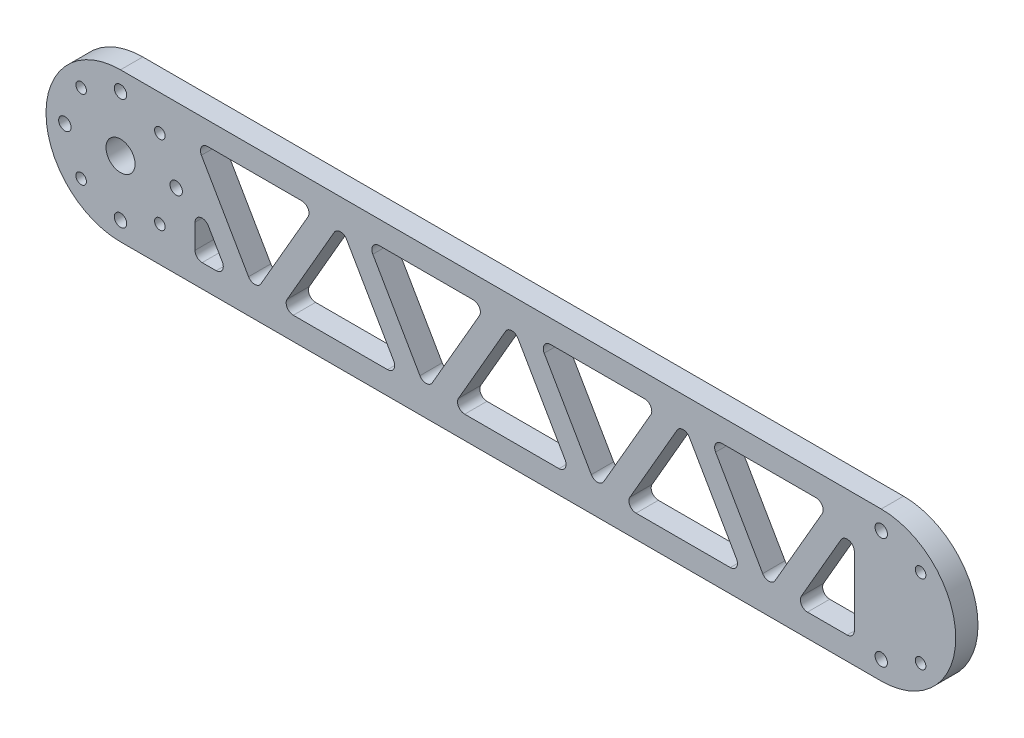
from build123d import *

# Parameters (mm, degrees)
SKETCH1_R              = 4
SKETCH1_R_2            = 1.75
SKETCH1_R_3            = 1.5
BOSS_EXTRUDE1_DEPTH    = 6
CUT_EXTRUDE1_DEPTH     = 226.966811722
FILLET1_R              = 2
MOVE_FACE1_OUTLINE_R   = 4
MOVE_FACE1_OUTLINE_R_2 = 3.92
MOVE_FACE1_OUTLINE_R_3 = 1.75
MOVE_FACE1_OUTLINE_R_4 = 1.67
MOVE_FACE1_OUTLINE_R_5 = 1.5
MOVE_FACE1_OUTLINE_R_6 = 1.42
MOVE_FACE1_DEPTH       = 6


# Read off the part's stored shape, not the designer's step: Move Face1
with BuildPart() as part:
    # Sketch1 → Boss-Extrude1 (new body)
    with BuildSketch(Plane.XY):
        with BuildLine():
            Line((205, 20), (0, 20))
            ThreePointArc((0, 20), (-20, 0), (0, -20))
            Line((0, -20), (205, -20))
            ThreePointArc((205, -20), (225, 0), (205, 20))
        make_face()
        Circle(SKETCH1_R, mode=Mode.SUBTRACT)
        with Locations((205, -15)):
            Circle(SKETCH1_R_2, mode=Mode.SUBTRACT)
        with Locations((215.606601718, -10.606601718)):
            Circle(SKETCH1_R_3, mode=Mode.SUBTRACT)
        with Locations((205, 15)):
            Circle(SKETCH1_R_2, mode=Mode.SUBTRACT)
        with Locations((215.606601718, 10.606601718)):
            Circle(SKETCH1_R_3, mode=Mode.SUBTRACT)
        with Locations((0, -15)):
            Circle(SKETCH1_R_2, mode=Mode.SUBTRACT)
        with Locations((10.606601718, -10.606601718)):
            Circle(SKETCH1_R_3, mode=Mode.SUBTRACT)
        with Locations((-15, 0)):
            Circle(SKETCH1_R_2, mode=Mode.SUBTRACT)
        with Locations((-10.606601718, -10.606601718)):
            Circle(SKETCH1_R_3, mode=Mode.SUBTRACT)
        with Locations((0, 15)):
            Circle(SKETCH1_R_2, mode=Mode.SUBTRACT)
        with Locations((-10.606601718, 10.606601718)):
            Circle(SKETCH1_R_3, mode=Mode.SUBTRACT)
        with Locations((15, 0)):
            Circle(SKETCH1_R_2, mode=Mode.SUBTRACT)
        with Locations((10.606601718, 10.606601718)):
            Circle(SKETCH1_R_3, mode=Mode.SUBTRACT)
    extrude(amount=BOSS_EXTRUDE1_DEPTH)

    # Sketch2 → Cut-Extrude1 (cut, through all)
    with BuildSketch(Plane.XY.offset(6)):
        Polygon((20, 14), (52.331615075, 14), (36.165807537, -14), align=None)
        Polygon((43.094010768, -14), (59.259818305, 14), (75.425625842, -14), align=None)
        Polygon((66.188021535, 14), (82.353829072, -14), (98.51963661, 14), align=None)
        Polygon((89.282032303, -14), (105.44783984, 14), (121.613647377, -14), align=None)
        Polygon((112.37604307, 14), (128.541850608, -14), (144.707658145, 14), align=None)
        Polygon((20, 2), (20, -14), (29.237604307, -14), align=None)
        Polygon((135.470053838, -14), (151.635861375, 14), (167.801668913, -14), align=None)
        Polygon((174.729872143, -14), (158.564064606, 14), (190.89567968, 14), align=None)
        Polygon((181.658075373, -14), (197.82388291, 14), (197.82388291, -14), align=None)
    extrude(amount=-CUT_EXTRUDE1_DEPTH, mode=Mode.SUBTRACT)

    # Fillet1
    fillet1_edges = [part.edges().sort_by_distance(p)[0] for p in [
        (121.613647377, -14, 3),
        (89.282032303, -14, 3),
        (105.44783984, 14, 3),
        (112.37604307, 14, 3),
        (144.707658145, 14, 3),
        (128.541850608, -14, 3),
        (20, 2, 3),
        (29.237604307, -14, 3),
        (20, -14, 3),
        (167.801668913, -14, 3),
        (135.470053838, -14, 3),
        (151.635861375, 14, 3),
        (190.89567968, 14, 3),
        (174.729872143, -14, 3),
        (158.564064606, 14, 3),
        (197.82388291, -14, 3),
        (181.658075373, -14, 3),
        (197.82388291, 14, 3),
        (36.165807537, -14, 3),
        (20, 14, 3),
        (52.331615075, 14, 3),
        (75.425625842, -14, 3),
        (43.094010768, -14, 3),
        (59.259818305, 14, 3),
        (66.188021535, 14, 3),
        (98.51963661, 14, 3),
        (82.353829072, -14, 3),
    ]]
    fillet(fillet1_edges, radius=FILLET1_R)

    # Move Face1 outline → Move Face1 (add)
    # profile 1 of 23: a face of its own
    with BuildSketch(Plane.XY):
        with BuildLine():
            ThreePointArc((205, -20.08), (225.08, 0), (205, 20.08))
            Line((205, 20.08), (0, 20.08))
            ThreePointArc((0, 20.08), (-20.08, 0), (0, -20.08))
            Line((0, -20.08), (205, -20.08))
        make_face()
        with BuildLine():
            Line((0, 20), (205, 20))
            ThreePointArc((205, 20), (225, 0), (205, -20))
            Line((205, -20), (0, -20))
            ThreePointArc((0, -20), (-20, 0), (0, 20))
        make_face(mode=Mode.SUBTRACT)
    # profile 2 of 23: a face of its own
    with BuildSketch(Plane.XY):
        Circle(MOVE_FACE1_OUTLINE_R)
        Circle(MOVE_FACE1_OUTLINE_R_2, mode=Mode.SUBTRACT)
    # profile 3 of 23: a face of its own
    with BuildSketch(Plane.XY):
        with Locations((205, -15)):
            Circle(MOVE_FACE1_OUTLINE_R_3)
        with Locations((205, -15)):
            Circle(MOVE_FACE1_OUTLINE_R_4, mode=Mode.SUBTRACT)
    # profile 4 of 23: a face of its own
    with BuildSketch(Plane.XY):
        with Locations((215.606601718, -10.606601718)):
            Circle(MOVE_FACE1_OUTLINE_R_5)
        with Locations((215.606601718, -10.606601718)):
            Circle(MOVE_FACE1_OUTLINE_R_6, mode=Mode.SUBTRACT)
    # profile 5 of 23: a face of its own
    with BuildSketch(Plane.XY):
        with Locations((205, 15)):
            Circle(MOVE_FACE1_OUTLINE_R_3)
        with Locations((205, 15)):
            Circle(MOVE_FACE1_OUTLINE_R_4, mode=Mode.SUBTRACT)
    # profile 6 of 23: a face of its own
    with BuildSketch(Plane.XY):
        with Locations((215.606601718, 10.606601718)):
            Circle(MOVE_FACE1_OUTLINE_R_5)
        with Locations((215.606601718, 10.606601718)):
            Circle(MOVE_FACE1_OUTLINE_R_6, mode=Mode.SUBTRACT)
    # profile 7 of 23: a face of its own
    with BuildSketch(Plane.XY):
        with Locations((0, -15)):
            Circle(MOVE_FACE1_OUTLINE_R_3)
        with Locations((0, -15)):
            Circle(MOVE_FACE1_OUTLINE_R_4, mode=Mode.SUBTRACT)
    # profile 8 of 23: a face of its own
    with BuildSketch(Plane.XY):
        with Locations((10.606601718, -10.606601718)):
            Circle(MOVE_FACE1_OUTLINE_R_5)
        with Locations((10.606601718, -10.606601718)):
            Circle(MOVE_FACE1_OUTLINE_R_6, mode=Mode.SUBTRACT)
    # profile 9 of 23: a face of its own
    with BuildSketch(Plane.XY):
        with Locations((-15, 0)):
            Circle(MOVE_FACE1_OUTLINE_R_3)
        with Locations((-15, 0)):
            Circle(MOVE_FACE1_OUTLINE_R_4, mode=Mode.SUBTRACT)
    # profile 10 of 23: a face of its own
    with BuildSketch(Plane.XY):
        with Locations((-10.606601718, -10.606601718)):
            Circle(MOVE_FACE1_OUTLINE_R_5)
        with Locations((-10.606601718, -10.606601718)):
            Circle(MOVE_FACE1_OUTLINE_R_6, mode=Mode.SUBTRACT)
    # profile 11 of 23: a face of its own
    with BuildSketch(Plane.XY):
        with Locations((0, 15)):
            Circle(MOVE_FACE1_OUTLINE_R_3)
        with Locations((0, 15)):
            Circle(MOVE_FACE1_OUTLINE_R_4, mode=Mode.SUBTRACT)
    # profile 12 of 23: a face of its own
    with BuildSketch(Plane.XY):
        with Locations((-10.606601718, 10.606601718)):
            Circle(MOVE_FACE1_OUTLINE_R_5)
        with Locations((-10.606601718, 10.606601718)):
            Circle(MOVE_FACE1_OUTLINE_R_6, mode=Mode.SUBTRACT)
    # profile 13 of 23: a face of its own
    with BuildSketch(Plane.XY):
        with Locations((15, 0)):
            Circle(MOVE_FACE1_OUTLINE_R_3)
        with Locations((15, 0)):
            Circle(MOVE_FACE1_OUTLINE_R_4, mode=Mode.SUBTRACT)
    # profile 14 of 23: a face of its own
    with BuildSketch(Plane.XY):
        with Locations((10.606601718, 10.606601718)):
            Circle(MOVE_FACE1_OUTLINE_R_5)
        with Locations((10.606601718, 10.606601718)):
            Circle(MOVE_FACE1_OUTLINE_R_6, mode=Mode.SUBTRACT)
    # profile 15 of 23: a face of its own
    with BuildSketch(Plane.XY):
        with BuildLine():
            ThreePointArc((23.464101615, 14), (21.732050808, 13), (21.732050808, 11))
            Line((21.732050808, 11), (34.43375673, -11))
            ThreePointArc((34.43375673, -11), (36.165807538, -12), (37.897858345, -11))
            Line((37.897858345, -11), (50.599564267, 11))
            ThreePointArc((50.599564267, 11), (50.599564267, 13), (48.867513459, 14))
            Line((48.867513459, 14), (23.464101615, 14))
        make_face()
        with BuildLine():
            Line((34.503038762, -10.96), (21.80133284, 11.04))
            ThreePointArc((21.80133284, 11.04), (21.80133284, 12.96), (23.464101615, 13.92))
            Line((23.464101615, 13.92), (48.867513459, 13.92))
            ThreePointArc((48.867513459, 13.92), (50.530282235, 12.96), (50.530282235, 11.04))
            Line((50.530282235, 11.04), (37.828576313, -10.96))
            ThreePointArc((37.828576313, -10.96), (36.165807538, -11.92), (34.503038762, -10.96))
        make_face(mode=Mode.SUBTRACT)
    # profile 16 of 23: a face of its own
    with BuildSketch(Plane.XY):
        with BuildLine():
            ThreePointArc((96.787585802, 11), (96.787585802, 13), (95.055534995, 14))
            Line((95.055534995, 14), (69.65212315, 14))
            ThreePointArc((69.65212315, 14), (67.920072343, 13), (67.920072343, 11))
            Line((67.920072343, 11), (80.621778265, -11))
            ThreePointArc((80.621778265, -11), (82.353829072, -12), (84.08587988, -11))
            Line((84.08587988, -11), (96.787585802, 11))
        make_face()
        with BuildLine():
            Line((69.65212315, 13.92), (95.055534995, 13.92))
            ThreePointArc((95.055534995, 13.92), (96.71830377, 12.96), (96.71830377, 11.04))
            Line((96.71830377, 11.04), (84.016597848, -10.96))
            ThreePointArc((84.016597848, -10.96), (82.353829073, -11.92), (80.691060297, -10.96))
            Line((80.691060297, -10.96), (67.989354375, 11.04))
            ThreePointArc((67.989354375, 11.04), (67.989354375, 12.96), (69.65212315, 13.92))
        make_face(mode=Mode.SUBTRACT)
    # profile 17 of 23: a face of its own
    with BuildSketch(Plane.XY):
        with BuildLine():
            ThreePointArc((142.975607337, 11), (142.975607337, 13), (141.24355653, 14))
            Line((141.24355653, 14), (115.840144685, 14))
            ThreePointArc((115.840144685, 14), (114.108093878, 13), (114.108093878, 11))
            Line((114.108093878, 11), (126.8097998, -11))
            ThreePointArc((126.8097998, -11), (128.541850608, -12), (130.273901415, -11))
            Line((130.273901415, -11), (142.975607337, 11))
        make_face()
        with BuildLine():
            Line((115.840144685, 13.92), (141.24355653, 13.92))
            ThreePointArc((141.24355653, 13.92), (142.906325305, 12.96), (142.906325305, 11.04))
            Line((142.906325305, 11.04), (130.204619383, -10.96))
            ThreePointArc((130.204619383, -10.96), (128.541850608, -11.92), (126.879081832, -10.96))
            Line((126.879081832, -10.96), (114.17737591, 11.04))
            ThreePointArc((114.17737591, 11.04), (114.17737591, 12.96), (115.840144685, 13.92))
        make_face(mode=Mode.SUBTRACT)
    # profile 18 of 23: a face of its own
    with BuildSketch(Plane.XY):
        with BuildLine():
            ThreePointArc((189.163628873, 11), (189.163628873, 13), (187.431578065, 14))
            Line((187.431578065, 14), (162.028166221, 14))
            ThreePointArc((162.028166221, 14), (160.296115413, 13), (160.296115413, 11))
            Line((160.296115413, 11), (172.997821335, -11))
            ThreePointArc((172.997821335, -11), (174.729872142, -12), (176.46192295, -11))
            Line((176.46192295, -11), (189.163628873, 11))
        make_face()
        with BuildLine():
            Line((162.028166221, 13.92), (187.431578065, 13.92))
            ThreePointArc((187.431578065, 13.92), (189.09434684, 12.96), (189.09434684, 11.04))
            Line((189.09434684, 11.04), (176.392640918, -10.96))
            ThreePointArc((176.392640918, -10.96), (174.729872143, -11.92), (173.067103368, -10.96))
            Line((173.067103368, -10.96), (160.365397445, 11.04))
            ThreePointArc((160.365397445, 11.04), (160.365397445, 12.96), (162.028166221, 13.92))
        make_face(mode=Mode.SUBTRACT)
    # profile 19 of 23: a face of its own
    with BuildSketch(Plane.XY):
        with BuildLine():
            ThreePointArc((44.826061575, -11), (44.826061575, -13), (46.558112383, -14))
            Line((46.558112383, -14), (71.961524227, -14))
            ThreePointArc((71.961524227, -14), (73.693575035, -13), (73.693575035, -11))
            Line((73.693575035, -11), (60.991869112, 11))
            ThreePointArc((60.991869112, 11), (59.259818305, 12), (57.527767497, 11))
            Line((57.527767497, 11), (44.826061575, -11))
        make_face()
        with BuildLine():
            Line((71.961524227, -13.92), (46.558112383, -13.92))
            ThreePointArc((46.558112383, -13.92), (44.895343607, -12.96), (44.895343607, -11.04))
            Line((44.895343607, -11.04), (57.59704953, 10.96))
            ThreePointArc((57.59704953, 10.96), (59.259818305, 11.92), (60.92258708, 10.96))
            Line((60.92258708, 10.96), (73.624293002, -11.04))
            ThreePointArc((73.624293002, -11.04), (73.624293002, -12.96), (71.961524227, -13.92))
        make_face(mode=Mode.SUBTRACT)
    # profile 20 of 23: a face of its own
    with BuildSketch(Plane.XY):
        with BuildLine():
            ThreePointArc((91.01408311, -11), (91.01408311, -13), (92.746133918, -14))
            Line((92.746133918, -14), (118.149545762, -14))
            ThreePointArc((118.149545762, -14), (119.88159657, -13), (119.88159657, -11))
            Line((119.88159657, -11), (107.179890648, 11))
            ThreePointArc((107.179890648, 11), (105.44783984, 12), (103.715789032, 11))
            Line((103.715789032, 11), (91.01408311, -11))
        make_face()
        with BuildLine():
            Line((118.149545762, -13.92), (92.746133918, -13.92))
            ThreePointArc((92.746133918, -13.92), (91.083365143, -12.96), (91.083365143, -11.04))
            Line((91.083365143, -11.04), (103.785071065, 10.96))
            ThreePointArc((103.785071065, 10.96), (105.44783984, 11.92), (107.110608615, 10.96))
            Line((107.110608615, 10.96), (119.812314538, -11.04))
            ThreePointArc((119.812314538, -11.04), (119.812314538, -12.96), (118.149545762, -13.92))
        make_face(mode=Mode.SUBTRACT)
    # profile 21 of 23: a face of its own
    with BuildSketch(Plane.XY):
        with BuildLine():
            ThreePointArc((20, -12), (20.585786438, -13.414213562), (22, -14))
            Line((22, -14), (25.773502692, -14))
            ThreePointArc((25.773502692, -14), (27.505553499, -13), (27.505553499, -11))
            Line((27.505553499, -11), (23.732050808, -4.464101615))
            ThreePointArc((23.732050808, -4.464101615), (21.48236191, -3.532249963), (20, -5.464101615))
            Line((20, -5.464101615), (20, -12))
        make_face()
        with BuildLine():
            Line((25.773502692, -13.92), (22, -13.92))
            ThreePointArc((22, -13.92), (20.64235498, -13.35764502), (20.08, -12))
            Line((20.08, -12), (20.08, -5.464101615))
            ThreePointArc((20.08, -5.464101615), (21.503067433, -3.609524029), (23.662768775, -4.504101615))
            Line((23.662768775, -4.504101615), (27.436271467, -11.04))
            ThreePointArc((27.436271467, -11.04), (27.436271467, -12.96), (25.773502692, -13.92))
        make_face(mode=Mode.SUBTRACT)
    # profile 22 of 23: a face of its own
    with BuildSketch(Plane.XY):
        with BuildLine():
            ThreePointArc((137.202104645, -11), (137.202104645, -13), (138.934155453, -14))
            Line((138.934155453, -14), (164.337567297, -14))
            ThreePointArc((164.337567297, -14), (166.069618105, -13), (166.069618105, -11))
            Line((166.069618105, -11), (153.367912183, 11))
            ThreePointArc((153.367912183, 11), (151.635861376, 12), (149.903810568, 11))
            Line((149.903810568, 11), (137.202104645, -11))
        make_face()
        with BuildLine():
            Line((164.337567297, -13.92), (138.934155453, -13.92))
            ThreePointArc((138.934155453, -13.92), (137.271386678, -12.96), (137.271386678, -11.04))
            Line((137.271386678, -11.04), (149.9730926, 10.96))
            ThreePointArc((149.9730926, 10.96), (151.635861375, 11.92), (153.298630151, 10.96))
            Line((153.298630151, 10.96), (166.000336073, -11.04))
            ThreePointArc((166.000336073, -11.04), (166.000336073, -12.96), (164.337567297, -13.92))
        make_face(mode=Mode.SUBTRACT)
    # profile 23 of 23: a face of its own
    with BuildSketch(Plane.XY):
        with BuildLine():
            ThreePointArc((183.390126181, -11), (183.390126181, -13), (185.122176988, -14))
            Line((185.122176988, -14), (195.82388291, -14))
            ThreePointArc((195.82388291, -14), (197.238096473, -13.414213563), (197.82388291, -12))
            Line((197.82388291, -12), (197.82388291, 6.535898385))
            ThreePointArc((197.82388291, 6.535898385), (196.341521, 8.467750037), (194.091832103, 7.535898385))
            Line((194.091832103, 7.535898385), (183.390126181, -11))
        make_face()
        with BuildLine():
            Line((195.82388291, -13.92), (185.122176988, -13.92))
            ThreePointArc((185.122176988, -13.92), (183.459408213, -12.96), (183.459408213, -11.04))
            Line((183.459408213, -11.04), (194.161114135, 7.495898385))
            ThreePointArc((194.161114135, 7.495898385), (196.320815477, 8.390475971), (197.74388291, 6.535898385))
            Line((197.74388291, 6.535898385), (197.74388291, -12))
            ThreePointArc((197.74388291, -12), (197.18152793, -13.35764502), (195.82388291, -13.92))
        make_face(mode=Mode.SUBTRACT)
    extrude(amount=MOVE_FACE1_DEPTH)


solid = part.part
